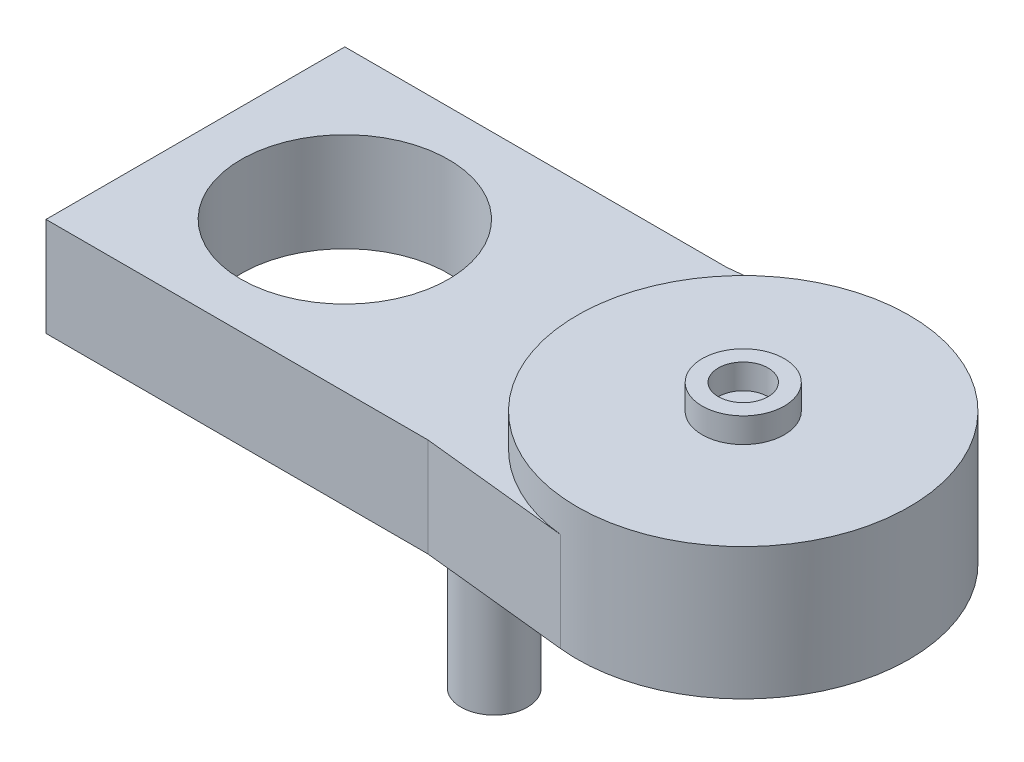
from build123d import *
from build123d.topology import SkipClean

# Parameters (mm, degrees)
SKETCH1_R           = 6.25
BOSS_EXTRUDE2_DEPTH = 5.95
SKETCH3_R           = 10
BOSS_EXTRUDE3_DEPTH = 2
SKETCH4_R           = 2
BOSS_EXTRUDE4_DEPTH = 10
SKETCH5_R           = 2.475
SKETCH5_R_2         = 1.5
BOSS_EXTRUDE5_DEPTH = 1.5


with BuildPart() as part:
    # Sketch1 → Boss-Extrude2 (new body)
    with BuildSketch(Plane(origin=(0, 0, 0), x_dir=(1, 0, 0), z_dir=(0, 1, 0))):
        with BuildLine():
            Line((14, 9), (22.950276243, 9.944751381))
            ThreePointArc((22.950276243, 9.944751381), (34, 0), (22.950276243, -9.944751381))
            Line((22.950276243, -9.944751381), (14, -9))
            Line((14, -9), (9, -9))
            Line((9, -9), (-9, -9))
            Line((-9, -9), (-9, 9))
            Line((-9, 9), (9, 9))
            Line((9, 9), (14, 9))
        make_face()
        Circle(SKETCH1_R, mode=Mode.SUBTRACT)
    extrude(amount=BOSS_EXTRUDE2_DEPTH)

    # Sketch3 → Boss-Extrude3 (add)
    with SkipClean():  # the faces are left unmerged after this step: merging them gives an invalid solid
        with BuildSketch(Plane(origin=(0, 5.95, 0), x_dir=(1, 0, 0), z_dir=(0, 1, 0))):
            with Locations((24, 0)):
                Circle(SKETCH3_R)
        extrude(amount=BOSS_EXTRUDE3_DEPTH)
    add(part.part.scale(1), mode=Mode.REPLACE)  # the faces are merged on a copy

    # Sketch4 → Boss-Extrude4 (add)
    with BuildSketch(Plane.XZ):
        with Locations((13, 4)):
            Circle(SKETCH4_R)
        with Locations((13, -4)):
            Circle(SKETCH4_R)
    extrude(amount=BOSS_EXTRUDE4_DEPTH)

    # Sketch5 → Boss-Extrude5 (add)
    with BuildSketch(Plane(origin=(0, 7.95, 0), x_dir=(1, 0, 0), z_dir=(0, 1, 0))):
        with Locations((24, 0)):
            Circle(SKETCH5_R)
        with Locations((24, 0)):
            Circle(SKETCH5_R_2, mode=Mode.SUBTRACT)
    extrude(amount=BOSS_EXTRUDE5_DEPTH)


solid = part.part
